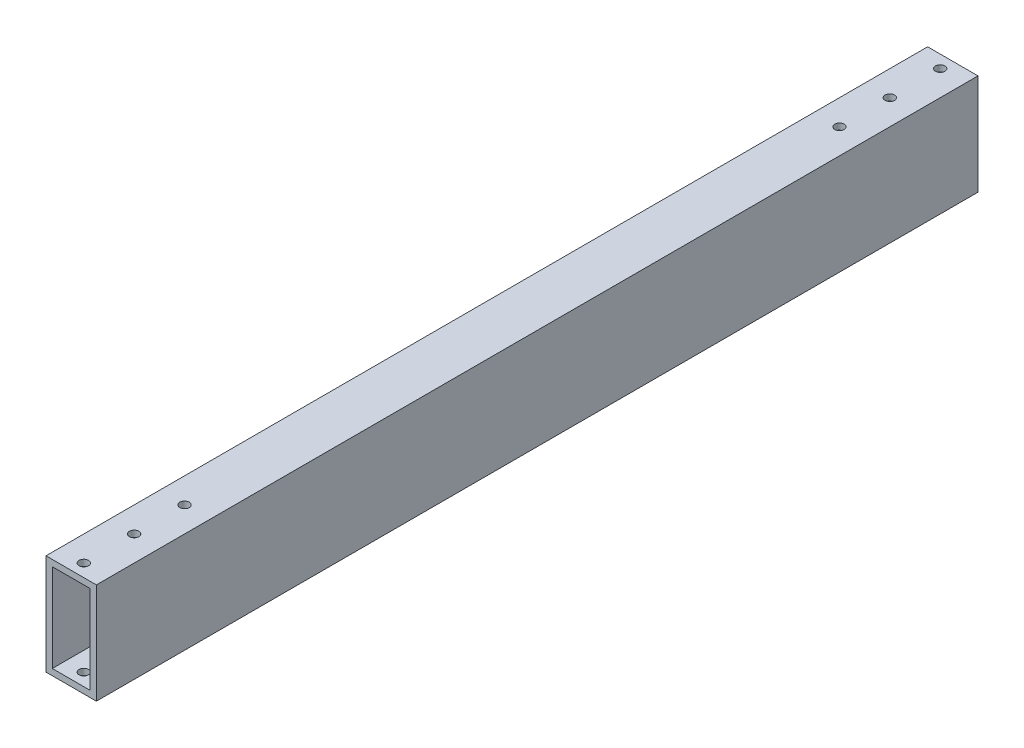
from build123d import *

# Parameters (mm, degrees)
SKETCH1_W           = 25.4
SKETCH1_H           = 50.8
BOSS_EXTRUDE1_DEPTH = 444.5
SHELL1_T            = -3.175
SKETCH2_R           = 2.38125
CUT_EXTRUDE1_DEPTH  = 448.573658742


with BuildPart() as part:
    # Sketch1 → Boss-Extrude1 (new body)
    with BuildSketch(Plane.XY):
        Rectangle(SKETCH1_W, SKETCH1_H)
    extrude(amount=BOSS_EXTRUDE1_DEPTH)

    # Shell1
    shell1_openings = [part.faces().sort_by_distance(p)[0] for p in [
        (0, 0, 0),
        (0, 0, 444.5),
    ]]
    offset(amount=SHELL1_T, openings=shell1_openings, kind=Kind.INTERSECTION)

    # Sketch2 → Cut-Extrude1 (cut, through all)
    with BuildSketch(Plane(origin=(0, 25.4, 0), x_dir=(1, 0, 0), z_dir=(0, 1, 0))):
        with Locations((0, -6.35)):
            Circle(SKETCH2_R)
        with Locations((0, -31.75)):
            Circle(SKETCH2_R)
        with Locations((0, -57.15)):
            Circle(SKETCH2_R)
        with Locations((0, -387.35)):
            Circle(SKETCH2_R)
        with Locations((0, -412.75)):
            Circle(SKETCH2_R)
        with Locations((0, -438.15)):
            Circle(SKETCH2_R)
    extrude(amount=-CUT_EXTRUDE1_DEPTH, mode=Mode.SUBTRACT)


solid = part.part
